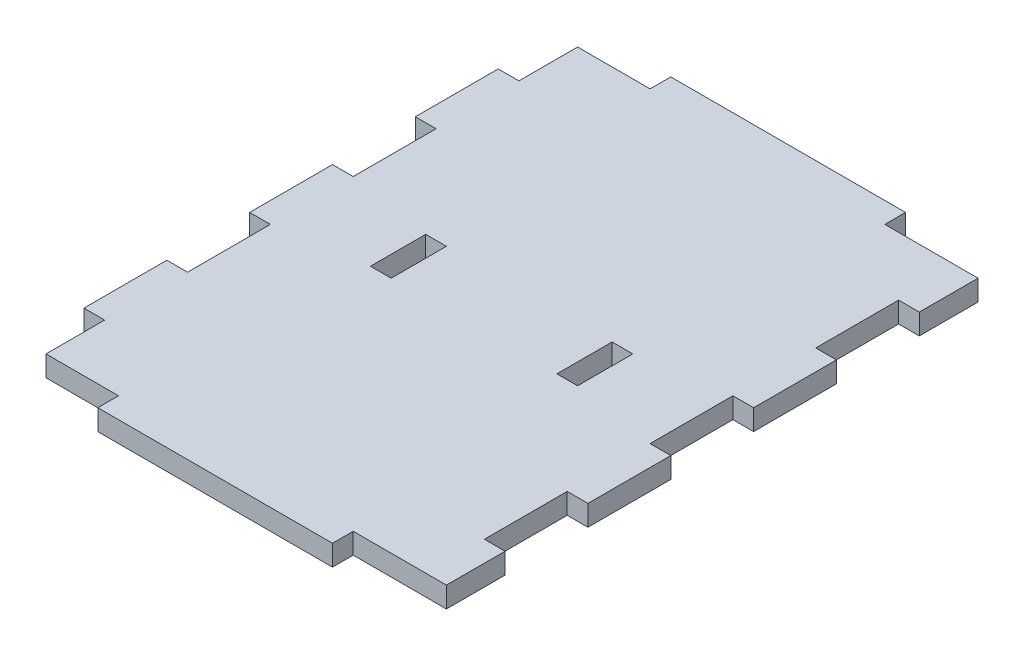
from build123d import *

# Parameters (mm, degrees)
SALIENTE_EXTRUIR1_DEPTH = 3
CORTAR_EXTRUIR1_DEPTH   = 10


with BuildPart() as part:
    # Croquis1 → Saliente-Extruir1 (new body)
    with BuildSketch(Plane(origin=(0, 0, 0), x_dir=(1, 0, 0), z_dir=(0, 1, 0))):
        Polygon((13.5, 3), (13.5, 0), (30.5, 0), (47.5, 0), (47.5, 3), (61, 3), (61, 11.5), (58, 11.5), (58, 23.5), (61, 23.5), (61, 35.5), (58, 35.5), (58, 47.5), (61, 47.5), (61, 59.5), (58, 59.5), (58, 71.5), (61, 71.5), (61, 80), (47.5, 80), (47.5, 83), (13.5, 83), (13.5, 80), (3, 80), (3, 71.5), (0, 71.5), (0, 59.5), (3, 59.5), (3, 47.5), (0, 47.5), (0, 35.5), (3, 35.5), (3, 23.5), (0, 23.5), (0, 11.5), (3, 11.5), (3, 3), align=None)
    extrude(amount=SALIENTE_EXTRUIR1_DEPTH)

    # Croquis2 → Cortar-Extruir1 (cut)
    with BuildSketch(Plane(origin=(0, 3, 0), x_dir=(1, 0, 0), z_dir=(0, 1, 0))):
        Polygon((18.5, 41.5), (18.5, 45.5), (15.5, 45.5), (15.5, 37.5), (18.5, 37.5), align=None)
        Polygon((42.5, 37.5), (42.5, 41.5), (42.5, 45.5), (45.5, 45.5), (45.5, 37.5), align=None)
    extrude(amount=-CORTAR_EXTRUIR1_DEPTH, mode=Mode.SUBTRACT)


solid = part.part
